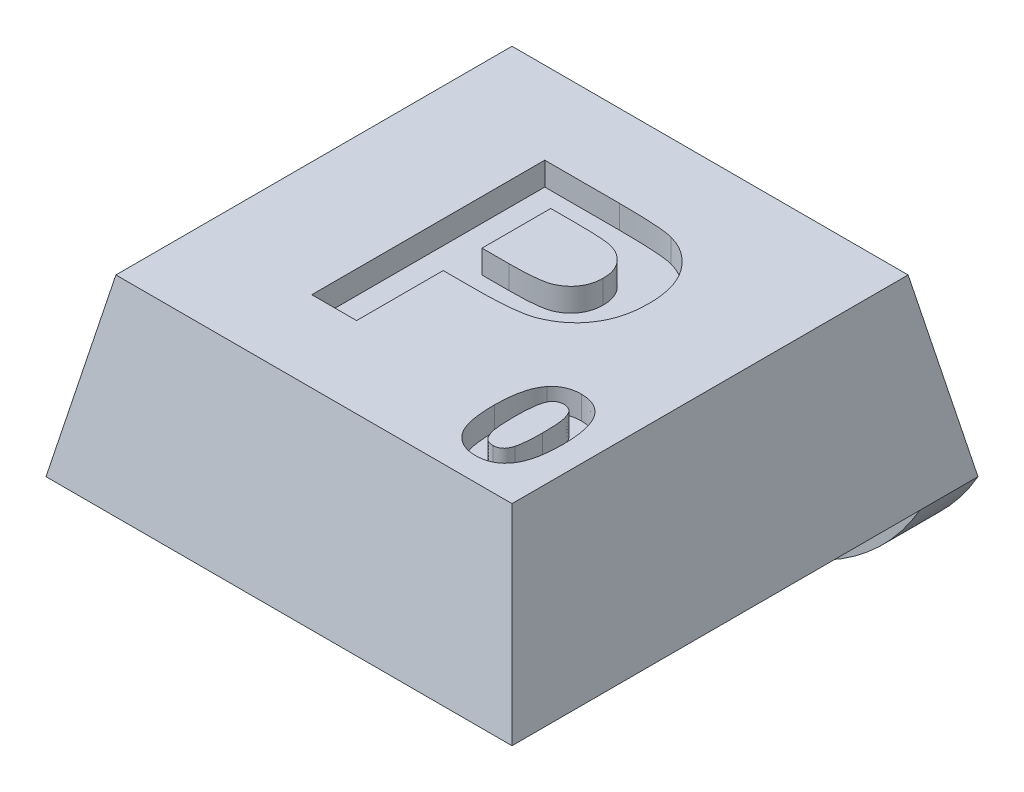
from build123d import *

# Parameters (mm, degrees)
SKETCH1_W               = 8
SKETCH1_H               = 8
BOSS_EXTRUDE1_DEPTH     = 3
CUT_EXTRUDE1_DEPTH      = 12.704699911
CUT_EXTRUDE1_DEPTH_BACK = 12.704699911
CUT_EXTRUDE2_DEPTH      = 11
SKETCH4_R               = 1.8
CUT_EXTRUDE3_DEPTH      = 0.8
SKETCH5_W               = 8
SKETCH5_H               = 1
BOSS_EXTRUDE2_DEPTH     = 2
FILLET1_R               = 4
CUT_EXTRUDE4_DEPTH      = 0.4
CUT_EXTRUDE5_DEPTH      = 0.4


with BuildPart() as part:
    # Sketch1 → Boss-Extrude1 (new body)
    with BuildSketch(Plane(origin=(0, 0, 0), x_dir=(1, 0, 0), z_dir=(0, 1, 0))):
        with Locations((4, 4)):
            Rectangle(SKETCH1_W, SKETCH1_H)
    extrude(amount=BOSS_EXTRUDE1_DEPTH)

    # Sketch2 → Cut-Extrude1 (cut, two sides: drawn at the far end of the back side and taken through both)
    with BuildSketch(Plane.XY.offset(-CUT_EXTRUDE1_DEPTH_BACK)):
        Polygon((0, 0), (0.6, 3), (0, 3), align=None)
        Polygon((8, 0), (7.4, 3), (8, 3), align=None)
    extrude(amount=CUT_EXTRUDE1_DEPTH + CUT_EXTRUDE1_DEPTH_BACK, mode=Mode.SUBTRACT)

    # Sketch3 → Cut-Extrude2 (cut)
    with BuildSketch(Plane(origin=(0, 0, 0), x_dir=(0, 0, -1), z_dir=(1, 0, 0))):
        Polygon((0, 0), (0.6, 3), (0, 3), align=None)
        Polygon((8, 3), (7.4, 3), (8, 0), align=None)
    extrude(amount=CUT_EXTRUDE2_DEPTH, mode=Mode.SUBTRACT)

    # Sketch4 → Cut-Extrude3 (cut)
    with BuildSketch(Plane.XZ):
        with Locations(Location((4, -3.75, 0), (0, 0, 270))):
            Circle(SKETCH4_R)
    extrude(amount=-CUT_EXTRUDE3_DEPTH, mode=Mode.SUBTRACT)

    # Sketch5 → Boss-Extrude2 (add)
    with BuildSketch(Plane.XZ):
        with Locations((4, -7.5)):
            Rectangle(SKETCH5_W, SKETCH5_H)
    extrude(amount=BOSS_EXTRUDE2_DEPTH)

    # Fillet1
    # the kernel refuses this fillet: 4 mm, written as the material it takes off along each edge
    with BuildSketch(Plane(origin=(8, -2, -16.660254038), x_dir=(0, 1, 0), z_dir=(0, 0, 1)), Plane(origin=(0, -2, 1.660254038), x_dir=(0, 1, 0), z_dir=(0, 0, -1))) as fillet1_piece_1:
        with BuildLine():
            CenterArc((4, 3.464101615), FILLET1_R, 180, 60)
            Line((0, 3.464101615), (-0.08, 3.464101615))
            Line((-0.08, 3.464101615), (-0.08, 0))
            Line((-0.08, 0), (0, -0.08))
            ThreePointArc((0, -0.08), (1, -0.08), (1.96, -0.069282032))
            Line((1.96, -0.069282032), (2, 0))
        make_face()
    extrude(amount=18.320508076, mode=Mode.SUBTRACT)

    # Sketch6 → Cut-Extrude4 (cut)
    with BuildSketch(Plane(origin=(0, 3, 0), x_dir=(1, 0, 0), z_dir=(0, 1, 0))):
        with BuildLine():
            Line((2.575068598, 1.987434605), (2.575068598, 5.987434605))
            Line((2.575068598, 5.987434605), (3.854716034, 5.987434605))
            add(Edge.make_bspline(
                [(3.854716034, 5.987434605), (3.91267733, 5.987371309), (4.0235352, 5.987250247), (4.181667245, 5.983886636), (4.324041461, 5.979125075), (4.450446542, 5.973194752), (4.561327274, 5.964345571), (4.656186257, 5.954098352), (4.735620814, 5.943075064), (4.782397472, 5.931667436), (4.803433983, 5.926537169)],
                knots=[0, 0, 0, 0, 1.460485487, 2.793352117, 3.985295279, 5.050041172, 5.981765236, 6.787433016, 7.454681457, 8, 8, 8, 8], degree=3))
            add(Edge.make_bspline(
                [(4.803433983, 5.926537169), (4.831407427, 5.918560862), (4.886928159, 5.902729762), (4.966472056, 5.868980371), (5.043139776, 5.829866627), (5.115968073, 5.783250114), (5.185204512, 5.72995844), (5.251054895, 5.670426205), (5.313870394, 5.604384669), (5.372782037, 5.531964292), (5.426738172, 5.453530256), (5.473369829, 5.368966598), (5.512437408, 5.278640875), (5.545722335, 5.183231873), (5.570280113, 5.081716653), (5.587466094, 4.974800554), (5.59942968, 4.862436815), (5.600276739, 4.785544235), (5.600709624, 4.746248708)],
                knots=[0, 0, 0, 0, 0.907145743, 1.80047177, 2.69161667, 3.591261238, 4.495029544, 5.415863088, 6.359363025, 7.337192411, 8.326890979, 9.326929023, 10.346104993, 11.395420813, 12.477187422, 13.601053412, 14.774031606, 16, 16, 16, 16], degree=3))
            add(Edge.make_bspline(
                [(5.600709624, 4.746248708), (5.599475039, 4.686573982), (5.597098394, 4.571696857), (5.570507962, 4.407006575), (5.529951011, 4.256572619), (5.470674098, 4.121843981), (5.398403226, 4.002291963), (5.318795373, 3.894516382), (5.227894903, 3.801765706), (5.129684965, 3.722543108), (5.025895009, 3.65771062), (4.921917172, 3.602441845), (4.816348426, 3.559949444), (4.744371889, 3.541435164), (4.708882701, 3.5323064)],
                knots=[0, 0, 0, 0, 1.312386234, 2.526415563, 3.661883817, 4.733421185, 5.753802465, 6.732107337, 7.675884281, 8.604170108, 9.50284679, 10.365392406, 11.194030444, 12, 12, 12, 12], degree=3))
            add(Edge.make_bspline(
                [(4.708882701, 3.5323064), (4.683552258, 3.527487955), (4.630158709, 3.517331247), (4.545479732, 3.507206857), (4.452921022, 3.496000262), (4.352101878, 3.488690691), (4.243144264, 3.481845584), (4.126090489, 3.478613784), (4.001107836, 3.47472012), (3.91508314, 3.474650156), (3.870741675, 3.474614092)],
                knots=[0, 0, 0, 0, 0.735353946, 1.55003838, 2.431865514, 3.394945452, 4.432993119, 5.54609699, 6.735134699, 8, 8, 8, 8], degree=3))
            Line((3.870741675, 3.474614092), (3.344299367, 3.474614092))
            Line((3.344299367, 3.474614092), (3.344299367, 1.987434605))
            Line((3.344299367, 1.987434605), (2.575068598, 1.987434605))
        make_face()
        with BuildLine():
            Line((3.344299367, 5.320767939), (3.344299367, 4.141280759))
            Line((3.344299367, 4.141280759), (3.805837829, 4.141280759))
            add(Edge.make_bspline(
                [(3.805837829, 4.141280759), (3.845638333, 4.141332297), (3.921781705, 4.141430897), (4.031030553, 4.144970031), (4.129922714, 4.149290201), (4.218664819, 4.156440966), (4.296721198, 4.165865503), (4.364614575, 4.177138437), (4.422424078, 4.189235472), (4.484937186, 4.209282199), (4.551776196, 4.241715975), (4.623152404, 4.288331456), (4.685856319, 4.344065763), (4.738034287, 4.409523776), (4.779712931, 4.482251421), (4.809554871, 4.56150336), (4.828823783, 4.645966113), (4.830583823, 4.704475652), (4.831478855, 4.734229477)],
                knots=[0, 0, 0, 0, 1.411705958, 2.700771114, 3.876961699, 4.922619712, 5.858038221, 6.66485904, 7.363650596, 7.950905807, 8.989198271, 9.987739806, 10.967313358, 11.951275539, 12.944273208, 13.927870418, 14.946261014, 16, 16, 16, 16], degree=3))
            add(Edge.make_bspline(
                [(4.831478855, 4.734229477), (4.830219195, 4.770469172), (4.827776882, 4.840733161), (4.800844983, 4.940800809), (4.759292142, 5.031613413), (4.699883375, 5.110345382), (4.628118983, 5.176552494), (4.547458802, 5.231639165), (4.456180297, 5.270189236), (4.391579581, 5.285125966), (4.358722444, 5.292723067)],
                knots=[0, 0, 0, 0, 1.085904563, 2.105425768, 3.088705091, 4.068969419, 5.045188284, 6.010769642, 6.988240112, 8, 8, 8, 8], degree=3))
            add(Edge.make_bspline(
                [(4.358722444, 5.292723067), (4.344583268, 5.294984513), (4.31319868, 5.300004222), (4.261031108, 5.305242912), (4.199316862, 5.310007496), (4.127981551, 5.313919362), (4.047307931, 5.316977535), (3.957029905, 5.319657249), (3.857385235, 5.319872528), (3.787674783, 5.320461199), (3.751350649, 5.320767939)],
                knots=[0, 0, 0, 0, 0.564603001, 1.253243608, 2.066786758, 3.005752288, 4.070476343, 5.250658742, 6.567396469, 8, 8, 8, 8], degree=3))
            Line((3.751350649, 5.320767939), (3.344299367, 5.320767939))
        make_face(mode=Mode.SUBTRACT)
    extrude(amount=-CUT_EXTRUDE4_DEPTH, mode=Mode.SUBTRACT)

    # Sketch7 → Cut-Extrude5 (cut)
    with BuildSketch(Plane(origin=(0, 3, 0), x_dir=(1, 0, 0), z_dir=(0, 1, 0))):
        with BuildLine():
            add(Edge.make_bspline(
                [(6.369450453, 2.82357546), (6.39087645, 2.823058679), (6.43259041, 2.822052565), (6.493372244, 2.81314022), (6.550601365, 2.79884977), (6.604273574, 2.778649207), (6.65433859, 2.752417608), (6.700462928, 2.720042876), (6.743654468, 2.682495475), (6.768596003, 2.65335807), (6.781229299, 2.638599499)],
                knots=[0, 0, 0, 0, 1.098584764, 2.138818609, 3.143716932, 4.11936356, 5.073598562, 6.034819447, 7.004603936, 8, 8, 8, 8], degree=3))
            add(Edge.make_bspline(
                [(6.781229299, 2.638599499), (6.788455746, 2.629200238), (6.803203657, 2.610017994), (6.823065779, 2.579021607), (6.842160507, 2.546141278), (6.858828341, 2.510585565), (6.874788514, 2.472971477), (6.889579056, 2.433213309), (6.902421223, 2.390982565), (6.914504951, 2.346819238), (6.924352081, 2.300033604), (6.93345174, 2.251130742), (6.940995767, 2.199888952), (6.946944677, 2.146472181), (6.952257643, 2.090961699), (6.955168891, 2.033092617), (6.957552583, 1.972994149), (6.95779081, 1.932111826), (6.957911991, 1.911315845)],
                knots=[0, 0, 0, 0, 0.746761706, 1.524009783, 2.317797294, 3.140957436, 3.996208027, 4.892396322, 5.812273159, 6.776774596, 7.776522781, 8.823794876, 9.910947555, 11.039215469, 12.21036455, 13.424061321, 14.689674014, 16, 16, 16, 16], degree=3))
            add(Edge.make_bspline(
                [(6.957911991, 1.911315845), (6.957792635, 1.890519816), (6.957558686, 1.84975752), (6.955160005, 1.789779622), (6.952255048, 1.732031195), (6.946957072, 1.676517748), (6.940951203, 1.623111596), (6.933622865, 1.571927247), (6.923838443, 1.523249094), (6.91414622, 1.47653808), (6.902133335, 1.432186718), (6.888714064, 1.390031707), (6.874517992, 1.349777916), (6.858186744, 1.312115406), (6.840920863, 1.276515693), (6.8221103, 1.24329975), (6.802026401, 1.212111266), (6.787135813, 1.192827825), (6.779786991, 1.183311037)],
                knots=[0, 0, 0, 0, 1.308387162, 2.564569672, 3.776470597, 4.945886788, 6.07248526, 7.158029334, 8.197718558, 9.195987466, 10.159061779, 11.087054987, 11.979325145, 12.84323098, 13.668471539, 14.467659354, 15.243757377, 16, 16, 16, 16], degree=3))
            add(Edge.make_bspline(
                [(6.779786991, 1.183311037), (6.767269282, 1.168678967), (6.742558721, 1.139794556), (6.69984521, 1.10255854), (6.653797336, 1.07085336), (6.603820502, 1.045143051), (6.550410554, 1.024803101), (6.493087779, 1.01096866), (6.432471995, 1.002038171), (6.390757271, 1.001019069), (6.369450453, 1.000498537)],
                knots=[0, 0, 0, 0, 0.991631672, 1.957528776, 2.911425699, 3.867574088, 4.848108326, 5.850523106, 6.902101959, 8, 8, 8, 8], degree=3))
            add(Edge.make_bspline(
                [(6.369450453, 1.000498537), (6.347900105, 1.001118641), (6.305671082, 1.002333766), (6.244014877, 1.011966411), (6.185407825, 1.027397849), (6.130060324, 1.049429828), (6.078051565, 1.077981657), (6.028975236, 1.112207425), (5.983899039, 1.153656886), (5.948609295, 1.192244047), (5.922791212, 1.227110384), (5.904581879, 1.256022799), (5.8869845, 1.286960237), (5.871795846, 1.320889957), (5.85681089, 1.35680842), (5.843538928, 1.395489719), (5.831829619, 1.436601232), (5.820835323, 1.479955232), (5.811667699, 1.525850343), (5.803234832, 1.574151127), (5.796589277, 1.625062995), (5.790697309, 1.678302375), (5.786549025, 1.733994943), (5.78318009, 1.792049563), (5.781490801, 1.852652064), (5.78115845, 1.893887179), (5.780988914, 1.914921614)],
                knots=[0, 0, 0, 0, 1.257818097, 2.464759732, 3.634271214, 4.790227596, 5.933394726, 7.09190477, 8.274482889, 9.50191983, 10.139172818, 10.805000628, 11.49619854, 12.215266328, 12.973768034, 13.768328009, 14.601232062, 15.469317089, 16.379095881, 17.333267023, 18.331755967, 19.376479622, 20.460535752, 21.592206075, 22.771760786, 24, 24, 24, 24], degree=3))
            add(Edge.make_bspline(
                [(5.780988914, 1.914921614), (5.781107317, 1.935597532), (5.781339371, 1.976119674), (5.783755545, 2.035856027), (5.786622112, 2.093367326), (5.791977754, 2.148754232), (5.797899386, 2.201932334), (5.805363507, 2.252971745), (5.814904658, 2.301608395), (5.825292905, 2.348036402), (5.836688103, 2.392420189), (5.850232122, 2.434388758), (5.864286307, 2.47457686), (5.880808434, 2.512038478), (5.897968312, 2.547563264), (5.916793594, 2.580772983), (5.936873788, 2.611963035), (5.951764856, 2.631246273), (5.959113914, 2.64076296)],
                knots=[0, 0, 0, 0, 1.304469132, 2.556591843, 3.77188756, 4.93702727, 6.066781583, 7.147865049, 8.190466662, 9.19316792, 10.149665317, 11.080258032, 11.975027628, 12.834388201, 13.661940433, 14.463366943, 15.241638981, 16, 16, 16, 16], degree=3))
            add(Edge.make_bspline(
                [(5.959113914, 2.64076296), (5.971630935, 2.655396438), (5.996340137, 2.684283628), (6.039063597, 2.721499302), (6.085162381, 2.753341336), (6.135285475, 2.778743904), (6.188572986, 2.799362705), (6.245820743, 2.81308675), (6.306426869, 2.822040809), (6.348142944, 2.823056613), (6.369450453, 2.82357546)],
                knots=[0, 0, 0, 0, 0.991667276, 1.957599061, 2.911530233, 3.873218945, 4.847995157, 5.850445929, 6.902062539, 8, 8, 8, 8], degree=3))
        make_face()
        with BuildLine():
            add(Edge.make_bspline(
                [(6.369450453, 2.52357546), (6.358474344, 2.523072492), (6.336762598, 2.522077575), (6.305205059, 2.514704272), (6.275401566, 2.502536716), (6.247208447, 2.485550965), (6.221248699, 2.461921448), (6.199258466, 2.430239338), (6.180267235, 2.391360135), (6.170763167, 2.362299534), (6.165724491, 2.346892768)],
                knots=[0, 0, 0, 0, 0.899391665, 1.779078861, 2.640979247, 3.529945348, 4.464599804, 5.495588918, 6.672261578, 8, 8, 8, 8], degree=3))
            add(Edge.make_bspline(
                [(6.165724491, 2.346892768), (6.162577751, 2.335267936), (6.155814574, 2.310283097), (6.148138649, 2.269547425), (6.141808472, 2.22331675), (6.136463277, 2.171601815), (6.132113414, 2.114375255), (6.12943462, 2.051600656), (6.127583085, 1.983322005), (6.127293442, 1.935956671), (6.127142761, 1.911315845)],
                knots=[0, 0, 0, 0, 0.658986521, 1.416336438, 2.266694271, 3.212608458, 4.261595115, 5.407496572, 6.651304179, 8, 8, 8, 8], degree=3))
            add(Edge.make_bspline(
                [(6.127142761, 1.911315845), (6.127348187, 1.886796916), (6.127741955, 1.839798243), (6.128860127, 1.772340716), (6.132034075, 1.710935357), (6.13521089, 1.655337457), (6.140502016, 1.605722201), (6.145823789, 1.56195561), (6.153158977, 1.524336592), (6.163167417, 1.483419148), (6.1783039, 1.440592552), (6.199070703, 1.397386801), (6.221339818, 1.362694606), (6.247568843, 1.337855227), (6.275956334, 1.321192362), (6.305399853, 1.308949279), (6.336928655, 1.302079246), (6.358481863, 1.301031661), (6.369450453, 1.300498537)],
                knots=[0, 0, 0, 0, 1.613353868, 3.092528792, 4.438413522, 5.658843895, 6.755779493, 7.721003256, 8.558527904, 9.275869043, 10.491421475, 11.538327284, 12.426656321, 13.187490948, 13.890032692, 14.581719216, 15.278226227, 16, 16, 16, 16], degree=3))
            add(Edge.make_bspline(
                [(6.369450453, 1.300498537), (6.380552792, 1.300975995), (6.402279645, 1.301910363), (6.43387853, 1.309529508), (6.463724458, 1.321331197), (6.49172893, 1.338663267), (6.517664365, 1.362130987), (6.539638544, 1.393841567), (6.558634851, 1.432711767), (6.568138148, 1.461773737), (6.573176414, 1.477181229)],
                knots=[0, 0, 0, 0, 0.909107913, 1.77908945, 2.650019014, 3.530482969, 4.465025013, 5.495890128, 6.672421267, 8, 8, 8, 8], degree=3))
            add(Edge.make_bspline(
                [(6.573176414, 1.477181229), (6.576318602, 1.488806983), (6.583041211, 1.513679902), (6.590771833, 1.554161984), (6.597119148, 1.600153094), (6.602413521, 1.651632777), (6.606806169, 1.708735723), (6.609462225, 1.771391927), (6.611315501, 1.839550023), (6.611606904, 1.886795193), (6.611758145, 1.911315845)],
                knots=[0, 0, 0, 0, 0.66114423, 1.414496391, 2.261103113, 3.210114492, 4.255954433, 5.405607896, 6.653488082, 8, 8, 8, 8], degree=3))
            add(Edge.make_bspline(
                [(6.611758145, 1.911315845), (6.611774868, 1.935837341), (6.611806925, 1.982844637), (6.609683032, 2.050387788), (6.607598618, 2.111974025), (6.603348141, 2.167482706), (6.599090914, 2.217101297), (6.592748703, 2.260581375), (6.586359424, 2.29840217), (6.575440132, 2.339234347), (6.560600724, 2.382184019), (6.540327287, 2.425838727), (6.517410268, 2.460205717), (6.491371352, 2.485467178), (6.463123586, 2.502496295), (6.433607808, 2.51477653), (6.402132873, 2.522065414), (6.380424737, 2.523068408), (6.369450453, 2.52357546)],
                knots=[0, 0, 0, 0, 1.611146624, 3.088541111, 4.440175916, 5.659517762, 6.746360572, 7.711365618, 8.546319149, 9.264661039, 10.486047304, 11.528122518, 12.419721574, 13.184982167, 13.89070983, 14.574167459, 15.279187713, 16, 16, 16, 16], degree=3))
        make_face(mode=Mode.SUBTRACT)
    extrude(amount=-CUT_EXTRUDE5_DEPTH, mode=Mode.SUBTRACT)


solid = part.part
